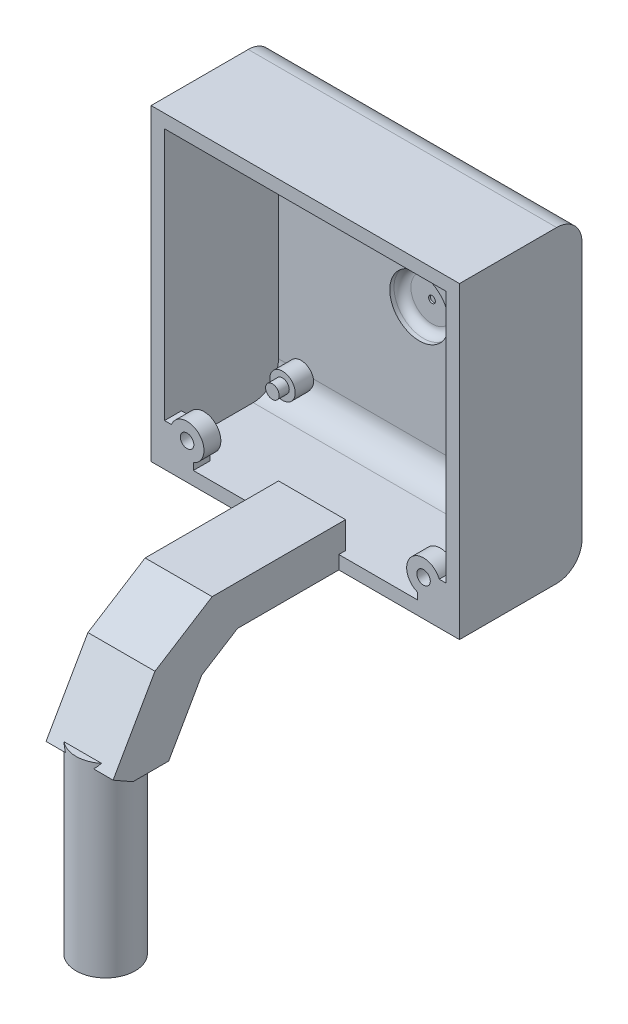
from build123d import *

# Parameters (mm, degrees)
SKETCH1_W            = 36.5125
SKETCH1_H            = 36.5125
EXTRUDE1_DEPTH       = 1
SKETCH2_W            = 36.5125
SKETCH2_H            = 36.5125
SKETCH2_W_2          = 33.3375
SKETCH2_H_2          = 33.3375
EXTRUDE2_DEPTH       = 13.5
FILLET7_R            = 3
SKETCH5_R            = 1.5
EXTRUDE5_DEPTH       = 2.2
SKETCH6_R            = 0.8
EXTRUDE6_DEPTH       = 1.2
SKETCH7_R            = 4.5
EXTRUDE7_DEPTH       = 2.5
SKETCH8_R            = 3.5
EXTRUDE9_DEPTH       = 1.5
FILLET8_R            = 1
FILLET10_R           = 1
SKETCH9_R            = 0.4
EXTRUDE10_DEPTH      = 0.2
EXTRUDE11_START      = -2
SKETCH10_R           = 0.8
EXTRUDE11_DEPTH      = 2
EXTRUDE12_DEPTH      = 15
EXTRUDE12_DEPTH_BACK = 0.8
SKETCH11_W           = 7.9375
SKETCH11_H           = 4.7625
SKETCH11_W_2         = 4.7625
SKETCH11_H_2         = 1.5875
EXTRUDE13_DEPTH      = 52.93619534
SKETCH13_W           = 7.9375
SKETCH13_H           = 5.628623833
SKETCH13_W_2         = 4.7625
SKETCH13_H_2         = 1.876207944
EXTRUDE14_DEPTH      = 8
EXTRUDE16_DEPTH      = 59.924573778
SKETCH16_W           = 7.9375
SKETCH16_H           = 6.378197728
SKETCH16_W_2         = 4.7625
SKETCH16_H_2         = 2.126065909
EXTRUDE17_DEPTH      = 10
EXTRUDE18_DEPTH      = 67.965816466
EXTRUDE19_DEPTH      = 20
EXTRUDE19_DEPTH_BACK = 2
SKETCH19_R           = 3.5
SKETCH19_R_2         = 2.2


with BuildPart() as part:
    # Sketch1 → Extrude1 (new body)
    with BuildSketch(Plane.XY):
        with Locations((18.25625, -18.25625)):
            Rectangle(SKETCH1_W, SKETCH1_H)
    extrude(amount=EXTRUDE1_DEPTH)

    # Sketch2 → Extrude2 (add)
    with BuildSketch(Plane.XY.offset(1)):
        with Locations((18.25625, -18.25625)):
            Rectangle(SKETCH2_W, SKETCH2_H)
        with Locations((18.25625, -18.25625)):
            Rectangle(SKETCH2_W_2, SKETCH2_H_2, mode=Mode.SUBTRACT)
    extrude(amount=EXTRUDE2_DEPTH)

    # Fillet7
    fillet7_edges = [part.edges().sort_by_distance(p)[0] for p in [
        (18.25625, 0, 0),
        (18.25625, -36.5125, 0),
        (18.25625, -1.5875, 1),
        (18.25625, -34.925, 1),
    ]]
    fillet(fillet7_edges, radius=FILLET7_R)

    # Sketch5 → Extrude5 (add)
    with BuildSketch(Plane.XY.offset(1)):
        with Locations((4.25625, -4.25625)):
            Circle(SKETCH5_R)
        with Locations((32.25625, -4.25625)):
            Circle(SKETCH5_R)
        with Locations((4.25625, -32.25625)):
            Circle(SKETCH5_R)
        with Locations((32.25625, -32.25625)):
            Circle(SKETCH5_R)
    extrude(amount=EXTRUDE5_DEPTH)

    # Sketch6 → Extrude6 (add)
    with BuildSketch(Plane.XY.offset(3.2)):
        with Locations((4.25625, -32.25625)):
            Circle(SKETCH6_R)
        with Locations((32.25625, -32.25625)):
            Circle(SKETCH6_R)
        with Locations((4.25625, -4.25625)):
            Circle(SKETCH6_R)
        with Locations((32.25625, -4.25625)):
            Circle(SKETCH6_R)
    extrude(amount=EXTRUDE6_DEPTH)

    # Sketch7 → Extrude7 (add)
    with BuildSketch(Plane.XY.offset(1)):
        with Locations((18.25625, -18.25625)):
            Circle(SKETCH7_R)
    extrude(amount=-EXTRUDE7_DEPTH)

    # Sketch8 → Extrude9 (cut)
    with BuildSketch(Plane.XY.offset(1)):
        with Locations((18.25625, -18.25625)):
            Circle(SKETCH8_R)
    extrude(amount=-EXTRUDE9_DEPTH, mode=Mode.SUBTRACT)

    # Fillet8
    fillet8_edges = [part.edges().sort_by_distance(p)[0] for p in [
        (13.75625, -18.25625, -1.5),
    ]]
    fillet(fillet8_edges, radius=FILLET8_R)

    # Fillet10
    fillet10_edges = [part.edges().sort_by_distance(p)[0] for p in [
        (14.75625, -18.25625, -0.5),
    ]]
    fillet(fillet10_edges, radius=FILLET10_R)

    # Sketch9 → Extrude10 (cut)
    with BuildSketch(Plane.XY.offset(-0.5)):
        with Locations((18.25625, -18.25625)):
            Circle(SKETCH9_R)
    extrude(amount=-EXTRUDE10_DEPTH, mode=Mode.SUBTRACT)

    # Sketch10 → Extrude11 (add)
    # profile 1 of 2: a face of its own
    with BuildSketch(Plane.XY.offset(14.5).offset(EXTRUDE11_START)):
        with BuildLine():
            Line((31.5125, -34.11281563), (31.5125, -36.512569909))
            Line((31.5125, -36.512569909), (36.5125, -36.5125))
            Line((36.5125, -36.5125), (36.5125, -31.5125))
            Line((36.5125, -31.5125), (34.11281563, -31.5125))
            ThreePointArc((34.11281563, -31.5125), (30.842036438, -30.842036438), (31.5125, -34.11281563))
        make_face()
        with Locations((32.25625, -32.25625)):
            Circle(SKETCH10_R, mode=Mode.SUBTRACT)
    # profile 2 of 2: a face of its own
    with BuildSketch(Plane.XY.offset(14.5).offset(EXTRUDE11_START)):
        with BuildLine():
            Line((2.39968437, -31.5125), (0, -31.5125))
            Line((0, -31.5125), (0, -36.5125))
            Line((0, -36.5125), (5, -36.5125))
            Line((5, -36.5125), (5, -34.11281563))
            ThreePointArc((5, -34.11281563), (5.670463562, -30.842036438), (2.39968437, -31.5125))
        make_face()
        with Locations((4.25625, -32.25625)):
            Circle(SKETCH10_R, mode=Mode.SUBTRACT)
    extrude(amount=EXTRUDE11_DEPTH)

    # Sketch11 → Extrude12 (add, two sides: drawn at the far end of the back side and taken through both)
    with BuildSketch(Plane.XY.offset(14.5).offset(-EXTRUDE12_DEPTH_BACK)):
        with Locations((18.25625, -34.13125)):
            Rectangle(SKETCH11_W, SKETCH11_H)
        with Locations((18.25625, -34.13125)):
            Rectangle(SKETCH11_W_2, SKETCH11_H_2, mode=Mode.SUBTRACT)
    extrude(amount=EXTRUDE12_DEPTH + EXTRUDE12_DEPTH_BACK)

    # Sketch12 → Extrude13 (cut, through all)
    with BuildSketch(Plane.ZY.offset(-14.2875)):
        Polygon((29.5, -36.5125), (29.5, -31.75), (26.5, -36.5125), align=None)
    extrude(amount=-EXTRUDE13_DEPTH, mode=Mode.SUBTRACT)

    # Sketch13 → Extrude14 (add)
    with BuildSketch(Plane(origin=(0, -22.32322784, 35.438124195), x_dir=(1, 0, 0), z_dir=(0, -0.5329899615200876, 0.8461215639131388))):
        with Locations((18.25625, -13.955467706)):
            Rectangle(SKETCH13_W, SKETCH13_H)
        with Locations((18.25625, -13.955467706)):
            Rectangle(SKETCH13_W_2, SKETCH13_H_2, mode=Mode.SUBTRACT)
    extrude(amount=EXTRUDE14_DEPTH)

    # Sketch15 → Extrude16 (cut, through all)
    with BuildSketch(Plane.ZY.offset(-14.2875)):
        Polygon((36.268972511, -36.013919692), (30.73060782, -39.177449808), (33.268972511, -40.776419692), align=None)
    extrude(amount=-EXTRUDE16_DEPTH, mode=Mode.SUBTRACT)

    # Sketch16 → Extrude17 (add)
    with BuildSketch(Plane(origin=(0, -42.774656661, 24.43300903), x_dir=(1, 0, 0), z_dir=(0, -0.8683275320760822, 0.49599122677589813))):
        with Locations((18.25625, 10.441660319)):
            Rectangle(SKETCH16_W, SKETCH16_H)
        with Locations((18.25625, 10.441660319)):
            Rectangle(SKETCH16_W_2, SKETCH16_H_2, mode=Mode.SUBTRACT)
    extrude(amount=EXTRUDE17_DEPTH)

    # Sketch18 → Extrude18 (cut, through all)
    with BuildSketch(Plane(origin=(22.225, 0, 0), x_dir=(0, 0, -1), z_dir=(1, 0, 0))):
        Polygon((-35.690520087, -47.860725128), (-34.64908856, -46.0375), (-38.882424481, -46.0375), align=None)
    extrude(amount=-EXTRUDE18_DEPTH, mode=Mode.SUBTRACT)

    # Sketch19 → Extrude19 (add, two sides: drawn at the far end of the back side and taken through both)
    with BuildSketch(Plane.XZ.offset(46.0375).offset(-EXTRUDE19_DEPTH_BACK)):
        with Locations((18.25625, 38.14908856)):
            Circle(SKETCH19_R)
        with Locations((18.25625, 38.14908856)):
            Circle(SKETCH19_R_2, mode=Mode.SUBTRACT)
    extrude(amount=EXTRUDE19_DEPTH + EXTRUDE19_DEPTH_BACK)


solid = part.part
